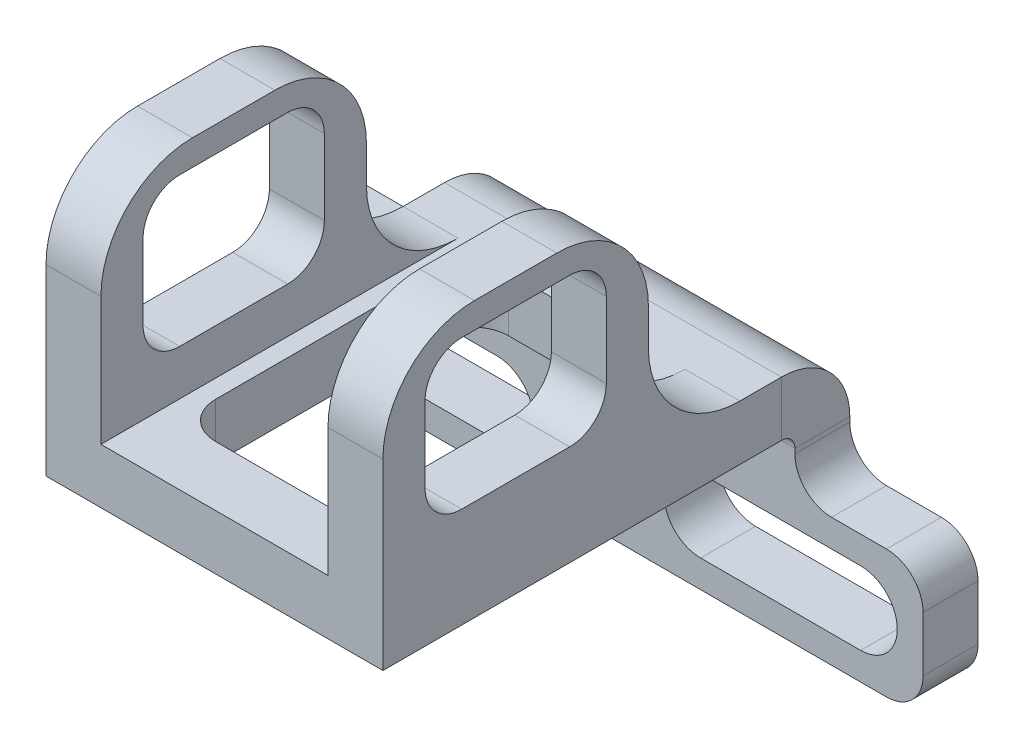
from build123d import *

# Parameters (mm, degrees)
FLANGE_BASE1_DEPTH             = 3
CORTE_EXTRUS_O1_DEPTH          = 3
ARESTA_FLANGE4_STRIP_W         = 13.4732
ARESTA_FLANGE4_STRIP_H         = 3
ARESTA_FLANGE4_STRIP_CUT_DEPTH = 18.4
ARESTA_FLANGE4_DEPTH           = 18.4
ESBO_O47_W                     = 14.5
ESBO_O47_H                     = 15
RESSALTO_EXTRUS_O1_DEPTH       = 3
FILETE1_R                      = 5
ESBO_O48_W                     = 14.5
ESBO_O48_H                     = 15
RESSALTO_EXTRUS_O2_DEPTH       = 3
FILETE2_R                      = 5
FILETE3_R                      = 2
CORTE_EXTRUS_O5_DEPTH          = 42.725642599
CORTE_EXTRUS_O6_DEPTH          = 3


# Sheet-metal steps are written as plain solids
with BuildPart() as part:
    # Esboço1 → Flange-base1 (new body)
    with BuildSketch(Plane.XY):
        Polygon((-14.370772566, 2.693459119), (-4.370772566, 2.693459119), (-4.370772566, 5.693459119), (14.029227434, 5.693459119), (14.029227434, 2.693459119), (21.029227434, 2.693459119), (21.029227434, -4.306540881), (-14.370772566, -4.306540881), align=None)
    extrude(amount=-FLANGE_BASE1_DEPTH)

    # Esboço8 → Corte-extrusão1 (cut)
    with BuildSketch(Plane.XY):
        with BuildLine():
            Line((-10.260200759, 1.193459119), (-2.260200759, 1.193459119))
            ThreePointArc((-2.260200759, 1.193459119), (-0.260200759, -0.806540881), (-2.260200759, -2.806540881))
            Line((-2.260200759, -2.806540881), (-10.260200759, -2.806540881))
            ThreePointArc((-10.260200759, -2.806540881), (-12.260200759, -0.806540881), (-10.260200759, 1.193459119))
        make_face()
        with BuildLine():
            Line((8.88097681, 1.193459119), (17.620096532, 1.193459119))
            ThreePointArc((17.620096532, 1.193459119), (19.620096532, -0.806540881), (17.620096532, -2.806540881))
            Line((17.620096532, -2.806540881), (8.88097681, -2.806540881))
            ThreePointArc((8.88097681, -2.806540881), (6.88097681, -0.806540881), (8.88097681, 1.193459119))
        make_face()
    extrude(amount=-CORTE_EXTRUS_O1_DEPTH, mode=Mode.SUBTRACT)

    # Aresta-Flange4 strip (across the edge) → Aresta-Flange4 strip cut (cut)
    with BuildSketch(Plane(origin=(14.029227434, 5.693459119, 0), x_dir=(0, -1, 0), z_dir=(-1, 0, 0))):
        with Locations((-6, -1.5)):
            Rectangle(ARESTA_FLANGE4_STRIP_W, ARESTA_FLANGE4_STRIP_H)
    extrude(amount=ARESTA_FLANGE4_STRIP_CUT_DEPTH, mode=Mode.SUBTRACT)

    # Aresta-Flange4 section (across the edge) → Aresta-Flange4 (add)
    with BuildSketch(Plane(origin=(14.029227434, 5.693459119, 0), x_dir=(0, -1, 0), z_dir=(-1, 0, 0))):
        with BuildLine():
            Line((-3, 0.7366), (-3, 22.5))
            Line((-3, 22.5), (0, 22.5))
            Line((0, 22.5), (0, 0.7366))
            ThreePointArc((0, 0.7366), (0.215745145, 0.215745145), (0.7366, 0))
            Line((0.7366, 0), (0.7366, -3))
            ThreePointArc((0.7366, -3), (-1.905575199, -1.905575199), (-3, 0.7366))
        make_face()
    extrude(amount=ARESTA_FLANGE4_DEPTH)

    # Esboço47 → Ressalto-extrusão1 (add)
    with BuildSketch(Plane(origin=(14.029227434, 0, 0), x_dir=(0, 0, -1), z_dir=(1, 0, 0))):
        with Locations((-15.25, 13.193459119)):
            Rectangle(ESBO_O47_W, ESBO_O47_H)
    extrude(amount=-RESSALTO_EXTRUS_O1_DEPTH)

    # Filete1
    filete1_edges = [part.edges().sort_by_distance(p)[0] for p in [
        (12.529227434, 20.693459119, 22.5),
        (12.529227434, 8.693459119, 8),
        (12.529227434, 20.693459119, 8),
    ]]
    fillet(filete1_edges, radius=FILETE1_R)

    # Esboço48 → Ressalto-extrusão2 (add)
    with BuildSketch(Plane.ZY.offset(4.370772566)):
        with Locations((15.25, 13.193459119)):
            Rectangle(ESBO_O48_W, ESBO_O48_H)
    extrude(amount=-RESSALTO_EXTRUS_O2_DEPTH)

    # Filete2
    filete2_edges = [part.edges().sort_by_distance(p)[0] for p in [
        (-2.870772566, 20.693459119, 22.5),
        (-2.870772566, 8.693459119, 8),
        (-2.870772566, 20.693459119, 8),
    ]]
    fillet(filete2_edges, radius=FILETE2_R)

    # Filete3
    filete3_edges = [part.edges().sort_by_distance(p)[0] for p in [
        (21.029227434, -4.306540881, -1.5),
        (-14.370772566, -4.306540881, -1.5),
        (-14.370772566, 2.693459119, -1.5),
        (-4.370772566, 2.693459119, -1.5),
        (14.029227434, 2.693459119, -1.5),
        (21.029227434, 2.693459119, -1.5),
    ]]
    fillet(filete3_edges, radius=FILETE3_R)

    # Esboço49 → Corte-extrusão5 (cut, through all)
    with BuildSketch(Plane(origin=(14.029227434, 0, 0), x_dir=(0, 0, -1), z_dir=(1, 0, 0))):
        with BuildLine():
            Line((-18.2, 11.175198381), (-12.3, 11.175198381))
            ThreePointArc((-12.3, 11.175198381), (-10.885786438, 11.760984819), (-10.3, 13.175198381))
            Line((-10.3, 13.175198381), (-10.3, 17.289297618))
            ThreePointArc((-10.3, 17.289297618), (-10.885786438, 18.70351118), (-12.3, 19.289297618))
            Line((-12.3, 19.289297618), (-18.2, 19.289297618))
            ThreePointArc((-18.2, 19.289297618), (-19.614213562, 18.70351118), (-20.2, 17.289297618))
            Line((-20.2, 17.289297618), (-20.2, 13.175198381))
            ThreePointArc((-20.2, 13.175198381), (-19.614213562, 11.760984819), (-18.2, 11.175198381))
        make_face()
    extrude(amount=-CORTE_EXTRUS_O5_DEPTH, mode=Mode.SUBTRACT)

    # Esboço50 → Corte-extrusão6 (cut)
    with BuildSketch(Plane.XZ.offset(-5.693459119)):
        with BuildLine():
            Line((1.629227434, 19.2366), (8.029227434, 19.2366))
            ThreePointArc((8.029227434, 19.2366), (9.443440996, 18.650813562), (10.029227434, 17.2366))
            Line((10.029227434, 17.2366), (10.029227434, 5.2366))
            ThreePointArc((10.029227434, 5.2366), (9.443440996, 3.822386438), (8.029227434, 3.2366))
            Line((8.029227434, 3.2366), (1.629227434, 3.2366))
            ThreePointArc((1.629227434, 3.2366), (0.215013871, 3.822386438), (-0.370772566, 5.2366))
            Line((-0.370772566, 5.2366), (-0.370772566, 17.2366))
            ThreePointArc((-0.370772566, 17.2366), (0.215013871, 18.650813562), (1.629227434, 19.2366))
        make_face()
    extrude(amount=-CORTE_EXTRUS_O6_DEPTH, mode=Mode.SUBTRACT)


solid = part.part
